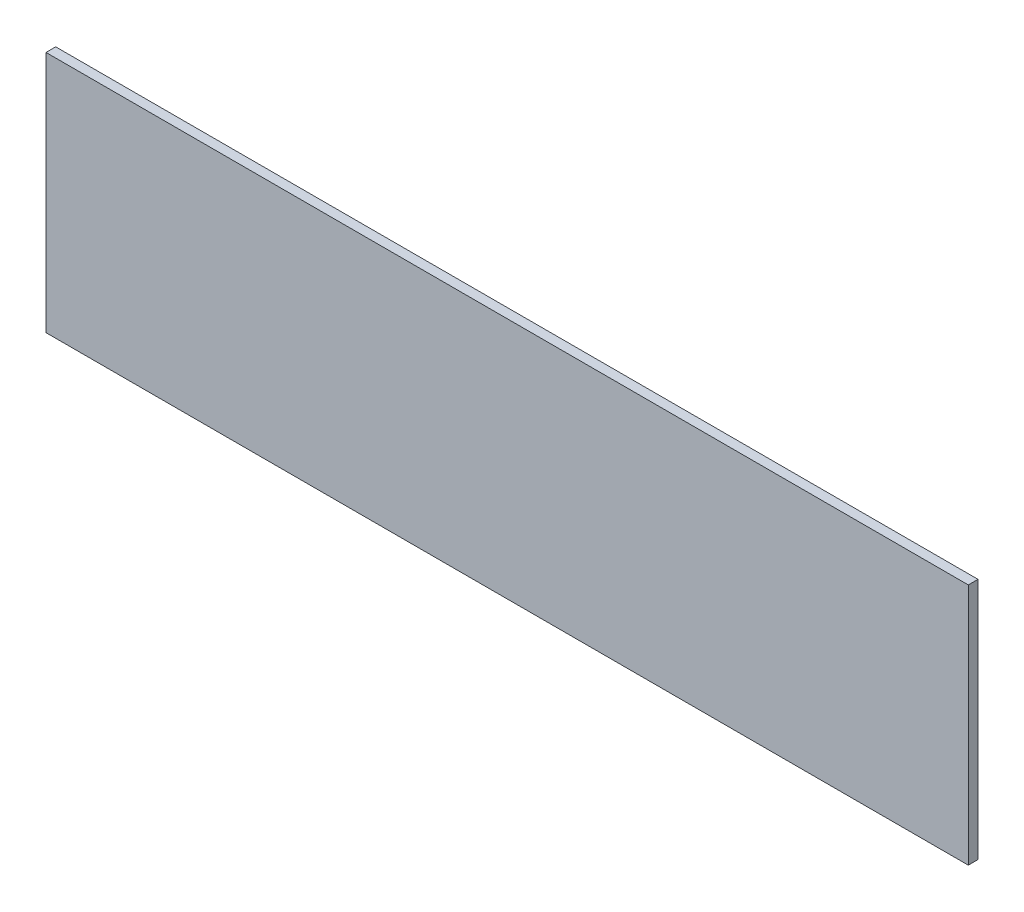
from build123d import *

# Parameters (mm, degrees)
ESQUISSE1_W        = 380
ESQUISSE1_H        = 100
BOSS_EXTRU_1_DEPTH = 4


with BuildPart() as part:
    # Esquisse1 → Boss.-Extru.1 (new body)
    with BuildSketch(Plane.XY):
        with Locations((50.554341942, 50.719339623)):
            Rectangle(ESQUISSE1_W, ESQUISSE1_H)
    extrude(amount=BOSS_EXTRU_1_DEPTH)


solid = part.part
